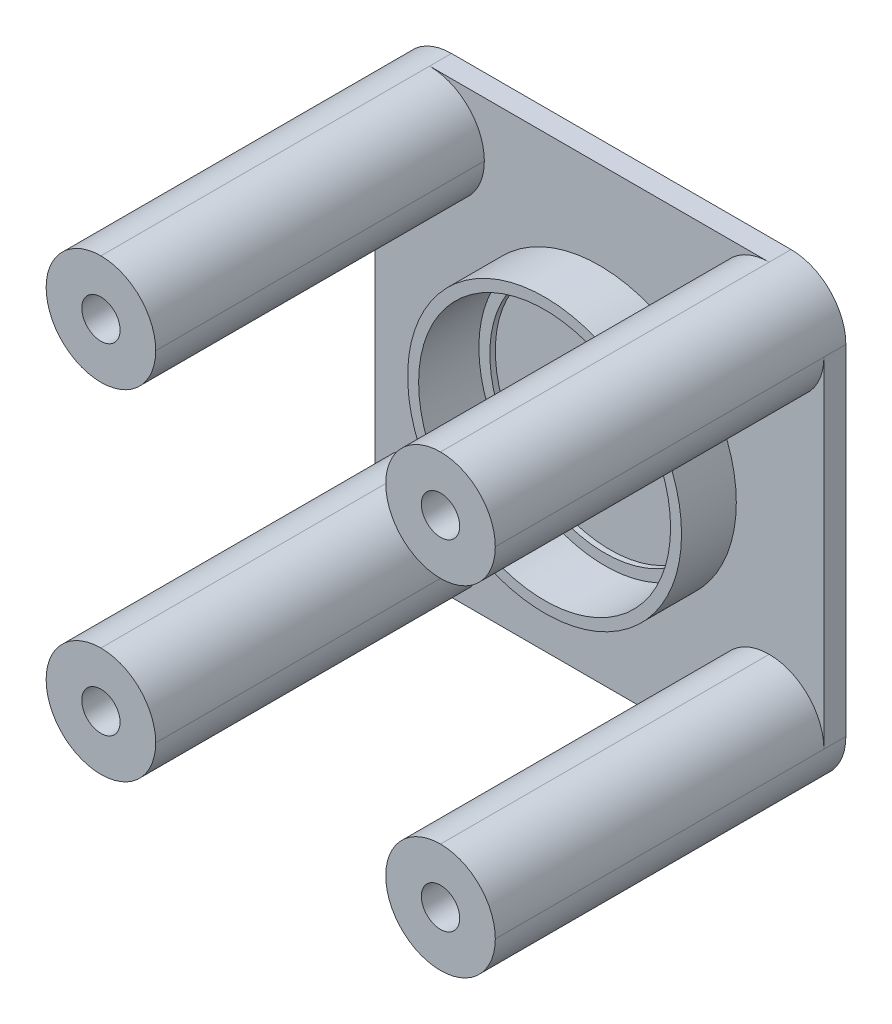
from build123d import *

# Parameters (mm, degrees)
SKETCH1_W           = 41
SKETCH1_H           = 41
SKETCH1_R           = 1.75
SKETCH1_R_2         = 1.25
BOSS_EXTRUDE1_DEPTH = 2
SKETCH2_W           = 10
SKETCH2_H           = 10
SKETCH2_R           = 1.75
BOSS_EXTRUDE2_DEPTH = 30
FILLET1_R           = 5
SKETCH3_R           = 10.5
CUT_EXTRUDE1_DEPTH  = 1
SKETCH4_R           = 11.5
CUT_EXTRUDE2_DEPTH  = 0.5
BOSS_EXTRUDE3_START = 5
SKETCH6_R           = 12.5
BOSS_EXTRUDE3_DEPTH = 5


with BuildPart() as part:
    # Sketch1 → Boss-Extrude1 (new body)
    with BuildSketch(Plane.XY):
        with Locations((-34.508333333, 4.35625)):
            Rectangle(SKETCH1_W, SKETCH1_H)
        with Locations((-50.008333333, 19.85625)):
            Circle(SKETCH1_R, mode=Mode.SUBTRACT)
        with Locations((-50.008333333, -11.14375)):
            Circle(SKETCH1_R, mode=Mode.SUBTRACT)
        with Locations((-19.008333333, -11.14375)):
            Circle(SKETCH1_R, mode=Mode.SUBTRACT)
        with Locations((-19.008333333, 19.85625)):
            Circle(SKETCH1_R, mode=Mode.SUBTRACT)
        with Locations((-34.508333333, 4.35625)):
            Circle(SKETCH1_R_2, mode=Mode.SUBTRACT)
    extrude(amount=BOSS_EXTRUDE1_DEPTH)

    # Sketch2 → Boss-Extrude2 (add)
    # profile 1 of 4: a face of its own
    with BuildSketch(Plane.XY.offset(2)):
        with Locations((-50.008333333, 19.85625)):
            Rectangle(SKETCH2_W, SKETCH2_H)
        with Locations((-50.008333333, 19.85625)):
            Circle(SKETCH2_R, mode=Mode.SUBTRACT)
    # profile 2 of 4: a face of its own
    with BuildSketch(Plane.XY.offset(2)):
        with Locations((-50.008333333, -11.14375)):
            Rectangle(SKETCH2_W, SKETCH2_H)
        with Locations((-50.008333333, -11.14375)):
            Circle(SKETCH2_R, mode=Mode.SUBTRACT)
    # profile 3 of 4: a face of its own
    with BuildSketch(Plane.XY.offset(2)):
        with Locations((-19.008333333, -11.14375)):
            Rectangle(SKETCH2_W, SKETCH2_H)
        with Locations((-19.008333333, -11.14375)):
            Circle(SKETCH2_R, mode=Mode.SUBTRACT)
    # profile 4 of 4: a face of its own
    with BuildSketch(Plane.XY.offset(2)):
        with Locations((-19.008333333, 19.85625)):
            Rectangle(SKETCH2_W, SKETCH2_H)
        with Locations((-19.008333333, 19.85625)):
            Circle(SKETCH2_R, mode=Mode.SUBTRACT)
    extrude(amount=BOSS_EXTRUDE2_DEPTH)

    # Fillet1
    fillet1_edges = [part.edges().sort_by_distance(p)[0] for p in [
        (-24.008333333, 24.85625, 17),
        (-24.008333333, -6.14375, 17),
        (-55.008333333, -6.14375, 17),
        (-55.008333333, 14.85625, 17),
        (-45.008333333, 24.85625, 17),
        (-45.008333333, -6.14375, 17),
        (-45.008333333, -16.14375, 17),
        (-24.008333333, -16.14375, 17),
        (-14.008333333, -6.14375, 17),
        (-14.008333333, 14.85625, 17),
        (-24.008333333, 14.85625, 17),
        (-45.008333333, 14.85625, 17),
        (-14.008333333, -16.14375, 16),
        (-14.008333333, 24.85625, 16),
        (-55.008333333, -16.14375, 16),
        (-55.008333333, 24.85625, 16),
    ]]
    fillet(fillet1_edges, radius=FILLET1_R - 0.0001)  # a hair under: the kernel refuses the full size

    # Sketch3 → Cut-Extrude1 (cut)
    with BuildSketch(Plane.XY.offset(2)):
        with Locations((-34.508333333, 4.35625)):
            Circle(SKETCH3_R)
    extrude(amount=-CUT_EXTRUDE1_DEPTH, mode=Mode.SUBTRACT)

    # Sketch4 → Cut-Extrude2 (cut)
    with BuildSketch(Plane.XY.offset(2)):
        with Locations((-34.508333333, 4.35625)):
            Circle(SKETCH4_R)
    extrude(amount=-CUT_EXTRUDE2_DEPTH, mode=Mode.SUBTRACT)

    # Sketch6 → Boss-Extrude3 (add)
    with BuildSketch(Plane.XY.offset(2).offset(BOSS_EXTRUDE3_START)):
        with Locations((-34.508333333, 4.35625)):
            Circle(SKETCH6_R)
        with BuildLine():
            ThreePointArc((-23.008333333, 4.35625), (-32.058371909, -6.879749689), (-44.964453163, -0.431187531))
            ThreePointArc((-44.964453163, -0.431187531), (-36.958294758, 15.592249689), (-23.008333333, 4.35625))
        make_face(mode=Mode.SUBTRACT)
    extrude(amount=-BOSS_EXTRUDE3_DEPTH)


solid = part.part
